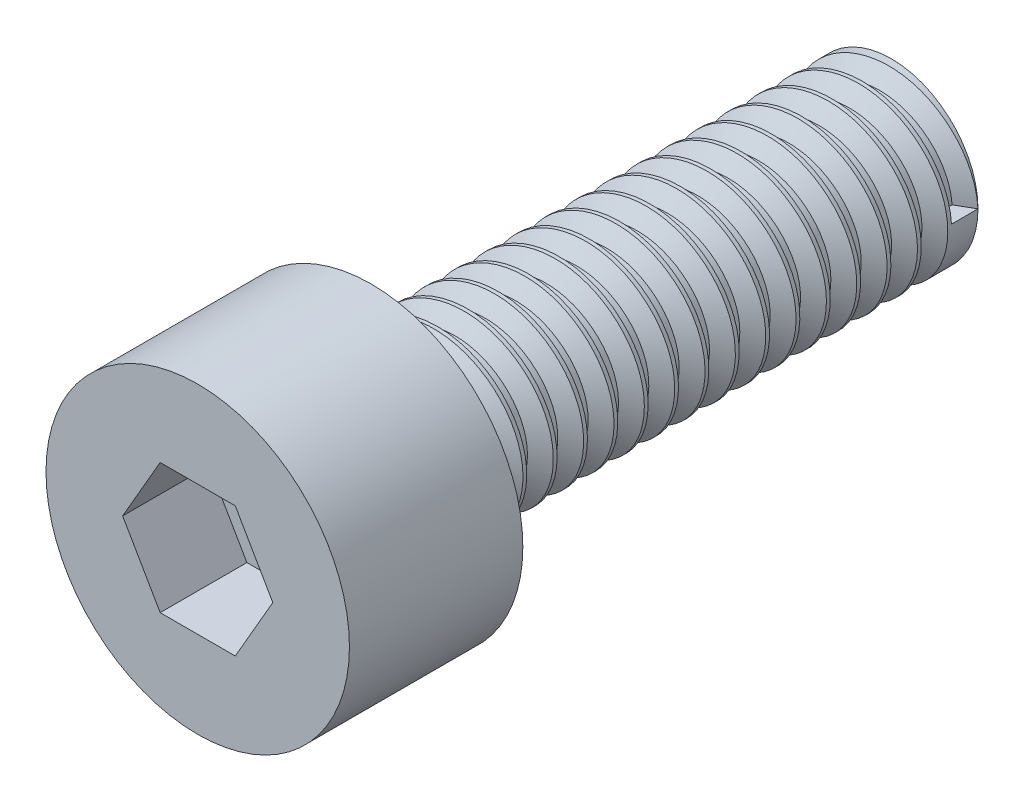
from build123d import *

# Parameters (mm, degrees)
SKETCH_1_R                = 2
EXTRUDE_3_10_DEPTH        = 12
M4X0_7_12_PITCH           = 0.7
SKETCH_2_R                = 3.5
EXTRUDE_5_5_3_DEPTH       = 4
CUT_EXTRUDE_2_5_1_5_DEPTH = 2


with BuildPart() as part:
    # Sketch 1 → 螺杆_直径3_长度10 (new body)
    with BuildSketch(Plane.XY):
        Circle(SKETCH_1_R)
    extrude(amount=EXTRUDE_3_10_DEPTH)

    # 真实螺纹_M4x0.7_右旋_长12: arcs per turn and ends read off the stored shape
    # 真实螺纹_M4x0.7_右旋_长12: the profile of Sketch 1 2 profile screwed along a right-hand helix through 17.142857 turns, 6 arcs to a turn; built about Z, then put on its axis
    m4x0_7_12_z = Axis((0, 0, 0), (0, 0, 1))
    m4x0_7_12_corners = [(2.0003, 0, -0.000173205), (2.0003, 0, 0.612673203), (1.621113887, 0, 0.393749999), (1.621113887, 0, 0.218749999)]
    with BuildLine(mode=Mode.PRIVATE) as m4x0_7_12_profile:
        Line(m4x0_7_12_corners[0], m4x0_7_12_corners[1])
        Line(m4x0_7_12_corners[1], m4x0_7_12_corners[2])
        Line(m4x0_7_12_corners[2], m4x0_7_12_corners[3])
        Line(m4x0_7_12_corners[3], m4x0_7_12_corners[0])
    m4x0_7_12_cap = Face(m4x0_7_12_profile.wire())
    m4x0_7_12_turn_angles = [0, 30, 60, 90, 120, 150, 180, 210, 240, 270, 300, 330, 360]
    m4x0_7_12_turn_weights = [1, 0.8660254037844387, 1, 0.8660254037844387, 1, 0.8660254037844387, 1, 0.8660254037844387, 1, 0.8660254037844387, 1, 0.8660254037844387, 1]
    m4x0_7_12_turn_rails = [Edge.make_bspline([Vector(p[0], p[1], 0).rotate(m4x0_7_12_z, m4x0_7_12_turn_angles[k]) / m4x0_7_12_turn_weights[k] + Vector(0, 0, p[2] + M4X0_7_12_PITCH * m4x0_7_12_turn_angles[k] / 360) for k in range(13)], [0, 0, 0, 1, 1, 2, 2, 3, 3, 4, 4, 5, 5, 6, 6, 6], 2, m4x0_7_12_turn_weights) for p in m4x0_7_12_corners]
    m4x0_7_12_turn_sides = [Face.make_surface_from_curves(m4x0_7_12_turn_rails[p[0]], m4x0_7_12_turn_rails[p[1]]) for p in [(0, 1), (1, 2), (2, 3), (3, 0)]]
    m4x0_7_12_turn = Solid(Shell([*m4x0_7_12_turn_sides, m4x0_7_12_cap, m4x0_7_12_cap.rotate(m4x0_7_12_z, 360).moved(Location((0, 0, M4X0_7_12_PITCH * 360 / 360)))]))
    m4x0_7_12_last_angles = [6120, 6145.714285714, 6171.428571429]
    m4x0_7_12_last_weights = [1, 0.9009688679024186, 1]
    m4x0_7_12_last_rails = [Edge.make_bspline([Vector(p[0], p[1], 0).rotate(m4x0_7_12_z, m4x0_7_12_last_angles[k]) / m4x0_7_12_last_weights[k] + Vector(0, 0, p[2] + M4X0_7_12_PITCH * m4x0_7_12_last_angles[k] / 360) for k in range(3)], [0, 0, 0, 1, 1, 1], 2, m4x0_7_12_last_weights) for p in m4x0_7_12_corners]
    m4x0_7_12_last_sides = [Face.make_surface_from_curves(m4x0_7_12_last_rails[p[0]], m4x0_7_12_last_rails[p[1]]) for p in [(0, 1), (1, 2), (2, 3), (3, 0)]]
    m4x0_7_12_last = Solid(Shell([*m4x0_7_12_last_sides, m4x0_7_12_cap.rotate(m4x0_7_12_z, 6120).moved(Location((0, 0, M4X0_7_12_PITCH * 6120 / 360))), m4x0_7_12_cap.rotate(m4x0_7_12_z, 6171.428571429).moved(Location((0, 0, M4X0_7_12_PITCH * 6171.428571429 / 360)))]))
    m4x0_7_12_each = [*[m4x0_7_12_turn.moved(Location((0, 0, M4X0_7_12_PITCH * i))) for i in range(17)], m4x0_7_12_last]
    add(Plane(origin=(0, 0, 0), x_dir=(1, 0, 0), z_dir=(0, 0, 1)) * Compound([m4x0_7_12_each[i] for i in range(0, 18, 2)]), mode=Mode.SUBTRACT)
    add(Plane(origin=(0, 0, 0), x_dir=(1, 0, 0), z_dir=(0, 0, 1)) * Compound([m4x0_7_12_each[i] for i in range(1, 18, 2)]), mode=Mode.SUBTRACT)

    # 草图2 → 杯头_直径5.5_厚度3 (add)
    with BuildSketch(Plane.XY.offset(12)):
        Circle(SKETCH_2_R)
    extrude(amount=EXTRUDE_5_5_3_DEPTH)

    # 草图3 → 内六角_对边2.5_深1.5 (cut)
    with BuildSketch(Plane.XY.offset(16)):
        Polygon((1.732050808, 0), (0.866025404, 1.5), (-0.866025404, 1.5), (-1.732050808, 0), (-0.866025404, -1.5), (0.866025404, -1.5), align=None)
    extrude(amount=-CUT_EXTRUDE_2_5_1_5_DEPTH, mode=Mode.SUBTRACT)


solid = part.part
